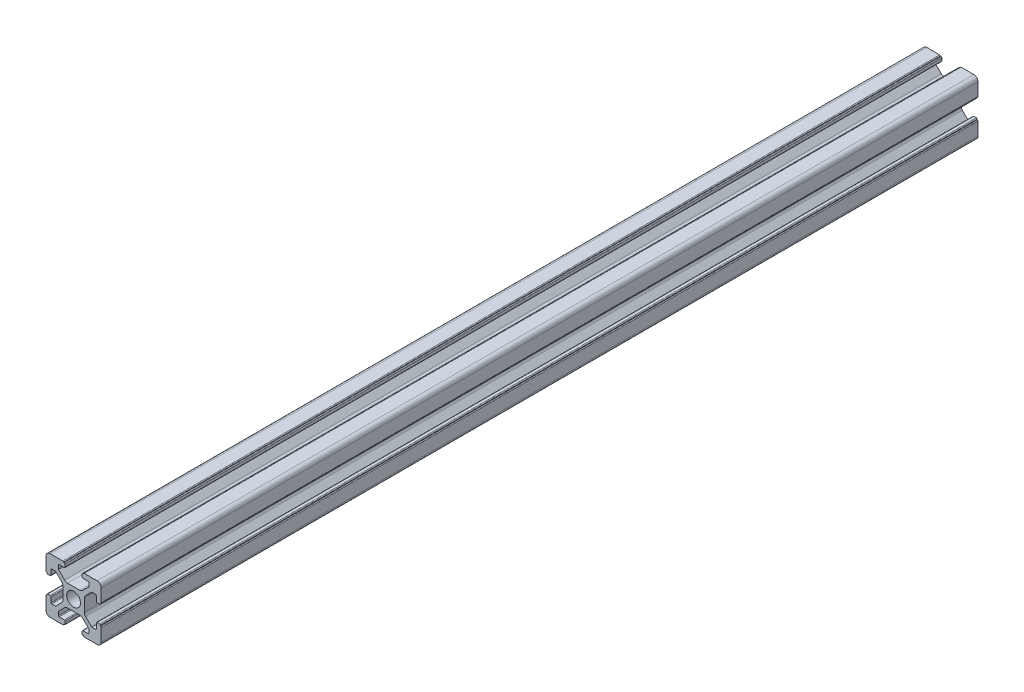
from build123d import *

# Parameters (mm, degrees)
BOSS_EXTRUDE1_DEPTH = 317.5
F_3DSKETCH2_R       = 2.5
CUT_EXTRUDE1_DEPTH  = 318.814911662


with BuildPart() as part:
    # Sketch1 → Boss-Extrude1 (new body)
    with BuildSketch(Plane.XY):
        with BuildLine():
            ThreePointArc((-4.339541497, 3.27832502), (-4.01438237, 2.791689997), (-3.900201668, 2.217664848))
            Line((-3.900201668, 2.217664848), (-3.900201668, -2.220777458))
            ThreePointArc((-3.900201668, -2.220777458), (-4.013982246, -2.793835668), (-4.338062619, -3.279956687))
            ThreePointArc((-4.338062619, -3.279956687), (-4.338801799, -3.280697416), (-4.339541497, -3.28143763))
            Line((-4.339541497, -3.28143763), (-6.559305445, -5.501201578))
            Line((-6.559305445, -5.501201578), (-7.918645273, -5.501201578))
            ThreePointArc((-7.918645273, -5.501201578), (-8.116635172, -5.419191476), (-8.198645273, -5.221201578))
            Line((-8.198645273, -5.221201578), (-8.198645273, -3.381201578))
            ThreePointArc((-8.198645273, -3.381201578), (-8.280655374, -3.183211679), (-8.478645273, -3.101201578))
            Line((-8.478645273, -3.101201578), (-9.418645273, -3.101201578))
            ThreePointArc((-9.418645273, -3.101201578), (-9.616635172, -3.183211679), (-9.698645273, -3.381201578))
            Line((-9.698645273, -3.381201578), (-9.698645273, -3.601201578))
            Line((-9.698645273, -3.601201578), (-9.718645273, -3.601201578))
            ThreePointArc((-9.718645273, -3.601201578), (-9.916635172, -3.683211679), (-9.998645273, -3.881201578))
            Line((-9.998645273, -3.881201578), (-9.998645273, -8.501201578))
            ThreePointArc((-9.998645273, -8.501201578), (-9.559305445, -9.561861749), (-8.498645273, -10.001201578))
            Line((-8.498645273, -10.001201578), (-3.878645273, -10.001201578))
            ThreePointArc((-3.878645273, -10.001201578), (-3.680655374, -9.919191476), (-3.598645273, -9.721201578))
            Line((-3.598645273, -9.721201578), (-3.598645273, -9.701201578))
            Line((-3.598645273, -9.701201578), (-3.378645273, -9.701201578))
            ThreePointArc((-3.378645273, -9.701201578), (-3.180655374, -9.619191476), (-3.098645273, -9.421201578))
            Line((-3.098645273, -9.421201578), (-3.098645273, -8.481201578))
            ThreePointArc((-3.098645273, -8.481201578), (-3.180655374, -8.283211679), (-3.378645273, -8.201201578))
            Line((-3.378645273, -8.201201578), (-5.218645273, -8.201201578))
            ThreePointArc((-5.218645273, -8.201201578), (-5.416635172, -8.119191476), (-5.498645273, -7.921201578))
            Line((-5.498645273, -7.921201578), (-5.498645273, -6.561861749))
            Line((-5.498645273, -6.561861749), (-3.277324929, -4.340541406))
            ThreePointArc((-3.277324929, -4.340541406), (-2.790689906, -4.015382279), (-2.216664757, -3.901201578))
            Line((-2.216664757, -3.901201578), (2.234977304, -3.899793498))
            ThreePointArc((2.234977304, -3.899793498), (2.801097117, -4.016727825), (3.280957809, -4.339061494))
            Line((3.280957809, -4.339061494), (5.502201668, -6.560305354))
            Line((5.502201668, -6.560305354), (5.502201668, -7.919645182))
            ThreePointArc((5.502201668, -7.919645182), (5.420191567, -8.117635081), (5.222201668, -8.199645182))
            Line((5.222201668, -8.199645182), (3.382201668, -8.199645182))
            ThreePointArc((3.382201668, -8.199645182), (3.18421177, -8.281655283), (3.102201668, -8.479645182))
            Line((3.102201668, -8.479645182), (3.102201668, -9.419645182))
            ThreePointArc((3.102201668, -9.419645182), (3.18421177, -9.617635081), (3.382201668, -9.699645182))
            Line((3.382201668, -9.699645182), (3.602201668, -9.699645182))
            Line((3.602201668, -9.699645182), (3.602201668, -9.719645182))
            ThreePointArc((3.602201668, -9.719645182), (3.68421177, -9.917635081), (3.882201668, -9.999645182))
            Line((3.882201668, -9.999645182), (8.502201668, -9.999645182))
            ThreePointArc((8.502201668, -9.999645182), (9.56286184, -9.560305354), (10.002201668, -8.499645182))
            Line((10.002201668, -8.499645182), (10.002201668, -3.879645182))
            ThreePointArc((10.002201668, -3.879645182), (9.920191567, -3.681655283), (9.722201668, -3.599645182))
            Line((9.722201668, -3.599645182), (9.702201668, -3.599645182))
            Line((9.702201668, -3.599645182), (9.702201668, -3.379645182))
            ThreePointArc((9.702201668, -3.379645182), (9.620191567, -3.181655283), (9.422201668, -3.099645182))
            Line((9.422201668, -3.099645182), (8.482201668, -3.099645182))
            ThreePointArc((8.482201668, -3.099645182), (8.28421177, -3.181655283), (8.202201668, -3.379645182))
            Line((8.202201668, -3.379645182), (8.202201668, -5.219645182))
            ThreePointArc((8.202201668, -5.219645182), (8.120191567, -5.417635081), (7.922201668, -5.499645182))
            Line((7.922201668, -5.499645182), (6.56286184, -5.499645182))
            Line((6.56286184, -5.499645182), (4.341541497, -3.278324838))
            ThreePointArc((4.341541497, -3.278324838), (4.01638237, -2.791689815), (3.902201668, -2.217664667))
            Line((3.902201668, -2.217664667), (3.900793589, 2.233977395))
            ThreePointArc((3.900793589, 2.233977395), (4.017727916, 2.800097207), (4.340061585, 3.2799579))
            Line((4.340061585, 3.2799579), (6.561305445, 5.501201759))
            Line((6.561305445, 5.501201759), (7.920645273, 5.501201759))
            ThreePointArc((7.920645273, 5.501201759), (8.118635172, 5.419191658), (8.200645273, 5.221201759))
            Line((8.200645273, 5.221201759), (8.200645273, 3.381201759))
            ThreePointArc((8.200645273, 3.381201759), (8.282655374, 3.183211861), (8.480645273, 3.101201759))
            Line((8.480645273, 3.101201759), (9.420645273, 3.101201759))
            ThreePointArc((9.420645273, 3.101201759), (9.618635172, 3.183211861), (9.700645273, 3.381201759))
            Line((9.700645273, 3.381201759), (9.700645273, 3.601201759))
            Line((9.700645273, 3.601201759), (9.720645273, 3.601201759))
            ThreePointArc((9.720645273, 3.601201759), (9.918635172, 3.683211861), (10.000645273, 3.881201759))
            Line((10.000645273, 3.881201759), (10.000645273, 8.501201759))
            ThreePointArc((10.000645273, 8.501201759), (9.561305445, 9.561861931), (8.500645273, 10.001201759))
            Line((8.500645273, 10.001201759), (3.880645273, 10.001201759))
            ThreePointArc((3.880645273, 10.001201759), (3.682655374, 9.919191658), (3.600645273, 9.721201759))
            Line((3.600645273, 9.721201759), (3.600645273, 9.701201759))
            Line((3.600645273, 9.701201759), (3.380645273, 9.701201759))
            ThreePointArc((3.380645273, 9.701201759), (3.182655374, 9.619191658), (3.100645273, 9.421201759))
            Line((3.100645273, 9.421201759), (3.100645273, 8.481201759))
            ThreePointArc((3.100645273, 8.481201759), (3.182655374, 8.283211861), (3.380645273, 8.201201759))
            Line((3.380645273, 8.201201759), (5.220645273, 8.201201759))
            ThreePointArc((5.220645273, 8.201201759), (5.418635172, 8.119191658), (5.500645273, 7.921201759))
            Line((5.500645273, 7.921201759), (5.500645273, 6.561861931))
            Line((5.500645273, 6.561861931), (3.279324929, 4.340541588))
            ThreePointArc((3.279324929, 4.340541588), (2.792689906, 4.015382461), (2.218664757, 3.901201759))
            Line((2.218664757, 3.901201759), (-2.232977304, 3.89979368))
            ThreePointArc((-2.232977304, 3.89979368), (-2.799097117, 4.016728006), (-3.278957809, 4.339061676))
            Line((-3.278957809, 4.339061676), (-5.500201668, 6.560305535))
            Line((-5.500201668, 6.560305535), (-5.500201668, 7.919645364))
            ThreePointArc((-5.500201668, 7.919645364), (-5.418191567, 8.117635262), (-5.220201668, 8.199645364))
            Line((-5.220201668, 8.199645364), (-3.380201668, 8.199645364))
            ThreePointArc((-3.380201668, 8.199645364), (-3.18221177, 8.281655465), (-3.100201668, 8.479645364))
            Line((-3.100201668, 8.479645364), (-3.100201668, 9.419645364))
            ThreePointArc((-3.100201668, 9.419645364), (-3.18221177, 9.617635262), (-3.380201668, 9.699645364))
            Line((-3.380201668, 9.699645364), (-3.600201668, 9.699645364))
            Line((-3.600201668, 9.699645364), (-3.600201668, 9.719645364))
            ThreePointArc((-3.600201668, 9.719645364), (-3.68221177, 9.917635262), (-3.880201668, 9.999645364))
            Line((-3.880201668, 9.999645364), (-8.500201668, 9.999645364))
            ThreePointArc((-8.500201668, 9.999645364), (-9.56086184, 9.560305535), (-10.000201668, 8.499645364))
            Line((-10.000201668, 8.499645364), (-10.000201668, 3.879645364))
            ThreePointArc((-10.000201668, 3.879645364), (-9.918191567, 3.681655465), (-9.720201668, 3.599645364))
            Line((-9.720201668, 3.599645364), (-9.700201668, 3.599645364))
            Line((-9.700201668, 3.599645364), (-9.700201668, 3.379645364))
            ThreePointArc((-9.700201668, 3.379645364), (-9.618191567, 3.181655465), (-9.420201668, 3.099645364))
            Line((-9.420201668, 3.099645364), (-8.480201668, 3.099645364))
            ThreePointArc((-8.480201668, 3.099645364), (-8.28221177, 3.181655465), (-8.200201668, 3.379645364))
            Line((-8.200201668, 3.379645364), (-8.200201668, 5.219645364))
            ThreePointArc((-8.200201668, 5.219645364), (-8.118191567, 5.417635262), (-7.920201668, 5.499645364))
            Line((-7.920201668, 5.499645364), (-6.56086184, 5.499645364))
            Line((-6.56086184, 5.499645364), (-4.339541497, 3.27832502))
        make_face()
    extrude(amount=BOSS_EXTRUDE1_DEPTH)

    # 3DSketch2 → Cut-Extrude1 (cut, through all)
    with BuildSketch(Plane.XY):
        Circle(F_3DSKETCH2_R)
    extrude(amount=CUT_EXTRUDE1_DEPTH, mode=Mode.SUBTRACT)


solid = part.part
